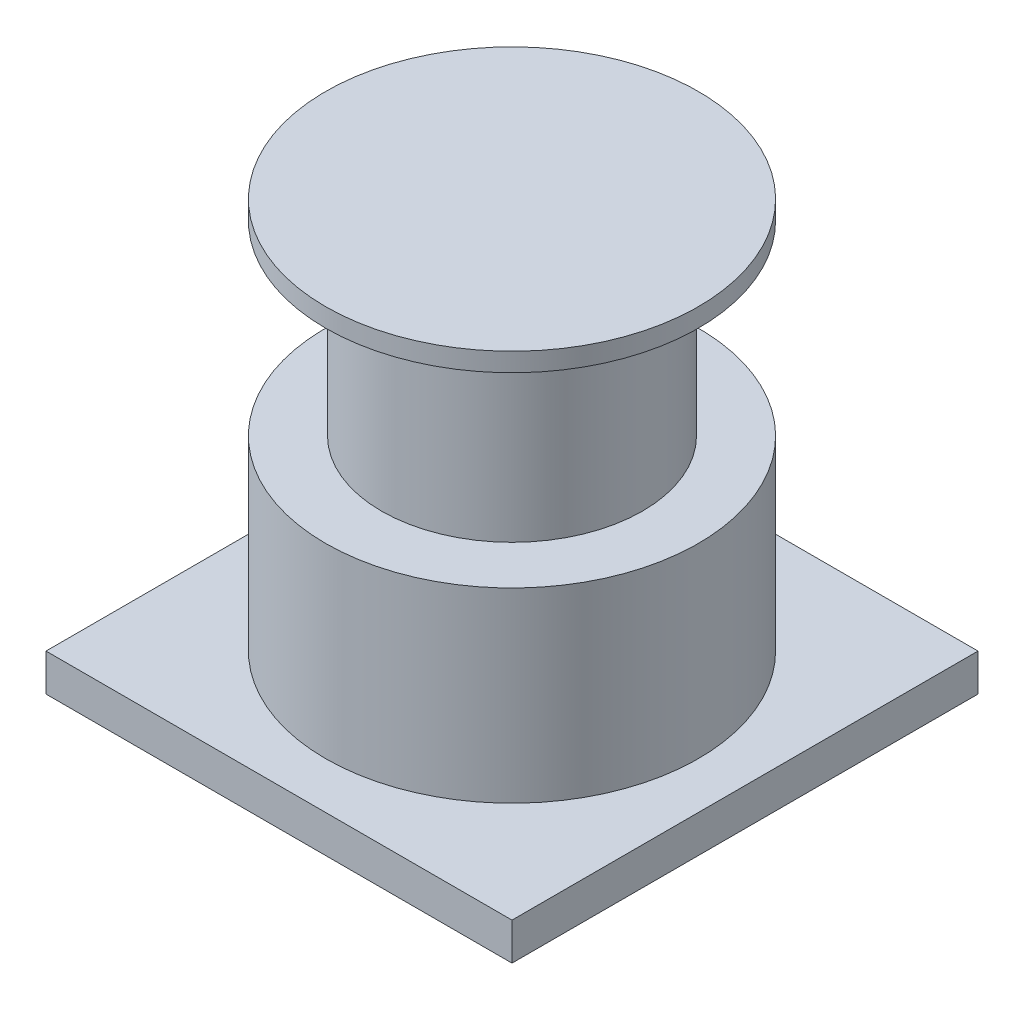
from build123d import *

# Parameters (mm, degrees)
SKETCH1_W           = 250
SKETCH1_H           = 250
BOSS_EXTRUDE1_DEPTH = 20
SKETCH2_R           = 100
BOSS_EXTRUDE2_DEPTH = 100
SKETCH3_R           = 70
BOSS_EXTRUDE3_DEPTH = 100
SKETCH4_R           = 100
BOSS_EXTRUDE4_DEPTH = 10


with BuildPart() as part:
    # Sketch1 → Boss-Extrude1 (new body)
    with BuildSketch(Plane(origin=(0, 0, 0), x_dir=(1, 0, 0), z_dir=(0, 1, 0))):
        with Locations((46.810699588, -38.16872428)):
            Rectangle(SKETCH1_W, SKETCH1_H)
    extrude(amount=BOSS_EXTRUDE1_DEPTH)

    # Sketch2 → Boss-Extrude2 (add)
    with BuildSketch(Plane(origin=(0, 20, 0), x_dir=(1, 0, 0), z_dir=(0, 1, 0))):
        with Locations((46.810699588, -38.16872428)):
            Circle(SKETCH2_R)
    extrude(amount=BOSS_EXTRUDE2_DEPTH)

    # Sketch3 → Boss-Extrude3 (add)
    with BuildSketch(Plane(origin=(0, 120, 0), x_dir=(1, 0, 0), z_dir=(0, 1, 0))):
        with Locations((46.810699588, -38.16872428)):
            Circle(SKETCH3_R)
    extrude(amount=BOSS_EXTRUDE3_DEPTH)

    # Sketch4 → Boss-Extrude4 (add)
    with BuildSketch(Plane(origin=(0, 220, 0), x_dir=(1, 0, 0), z_dir=(0, 1, 0))):
        with Locations((46.810699588, -38.16872428)):
            Circle(SKETCH4_R)
    extrude(amount=BOSS_EXTRUDE4_DEPTH)


solid = part.part
